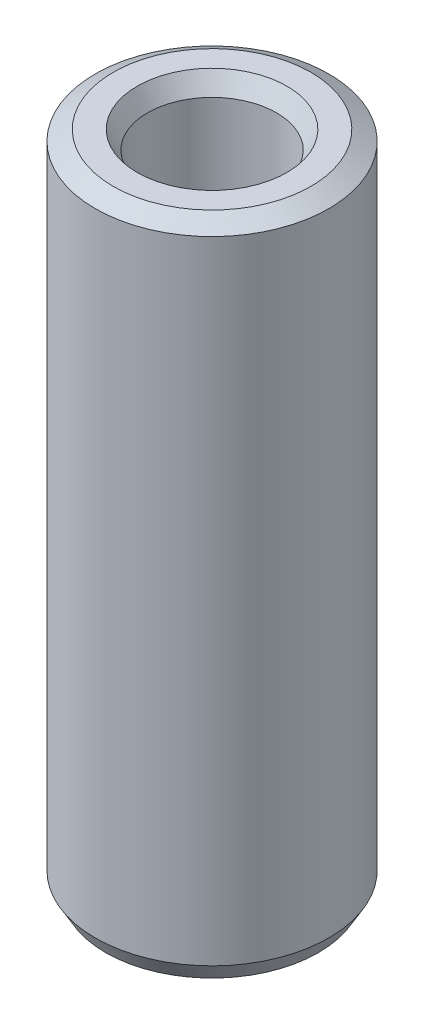
from build123d import *
from OCP.BRepFilletAPI import BRepFilletAPI_MakeChamfer

# Parameters (mm, degrees)
SKETCH1_R           = 5
BOSS_EXTRUDE1_DEPTH = 28.253985681
SKETCH2_R           = 2.762198737
CUT_EXTRUDE1_DEPTH  = 30.125379085
CHAMFER1_SIZE       = 0.44275724
CHAMFER1_SIZE2      = 0.766878034


with BuildPart() as part:
    # Sketch1 → Boss-Extrude1 (new body)
    with BuildSketch(Plane(origin=(0, 0, 0), x_dir=(1, 0, 0), z_dir=(0, 1, 0))):
        Circle(SKETCH1_R)
    extrude(amount=BOSS_EXTRUDE1_DEPTH)

    # Sketch2 → Cut-Extrude1 (cut, through all)
    with BuildSketch(Plane(origin=(0, 0, 0), x_dir=(1, 0, 0), z_dir=(0, 1, 0))):
        Circle(SKETCH2_R)
    extrude(amount=CUT_EXTRUDE1_DEPTH, mode=Mode.SUBTRACT)

    # Chamfer1: one chamfer whose edges measure the first distance from different faces: ONE call of the kernel's chamfer builder (chamfer() names one face for all edges)
    chamfer1_edges_1 = [part.edges().sort_by_distance(p)[0] for p in [
        (-2.762198737, 28.253985681, 0),
    ]]
    chamfer1_side_1 = [part.faces().sort_by_distance(p)[0] for p in [
        (-4.858578644, 28.253985681, 0),
    ]]
    chamfer1_edges_2 = [part.edges().sort_by_distance(p)[0] for p in [
        (-2.762198737, 0, 0),
    ]]
    chamfer1_side_2 = [part.faces().sort_by_distance(p)[0] for p in [
        (-2.762198737, 14.12699284, 0),
    ]]
    chamfer1_edges_3 = [part.edges().sort_by_distance(p)[0] for p in [
        (-5, 0, 0),
    ]]
    chamfer1_side_3 = [part.faces().sort_by_distance(p)[0] for p in [
        (-4.858578644, 0, 0),
    ]]
    chamfer1_edges_4 = [part.edges().sort_by_distance(p)[0] for p in [
        (-5, 28.253985681, 0),
    ]]
    chamfer1_side_4 = [part.faces().sort_by_distance(p)[0] for p in [
        (-5, 14.12699284, 0),
    ]]
    chamfer1 = BRepFilletAPI_MakeChamfer(part.part.solid().wrapped)
    for e in chamfer1_edges_1:
        chamfer1.Add(CHAMFER1_SIZE, CHAMFER1_SIZE2, e.wrapped, chamfer1_side_1[0].wrapped)  # the first distance lies on this face
    for e in chamfer1_edges_2:
        chamfer1.Add(CHAMFER1_SIZE, CHAMFER1_SIZE2, e.wrapped, chamfer1_side_2[0].wrapped)  # the first distance lies on this face
    for e in chamfer1_edges_3:
        chamfer1.Add(CHAMFER1_SIZE, CHAMFER1_SIZE2, e.wrapped, chamfer1_side_3[0].wrapped)  # the first distance lies on this face
    for e in chamfer1_edges_4:
        chamfer1.Add(CHAMFER1_SIZE, CHAMFER1_SIZE2, e.wrapped, chamfer1_side_4[0].wrapped)  # the first distance lies on this face
    add(Compound.cast(chamfer1.Shape()), mode=Mode.REPLACE)


solid = part.part
